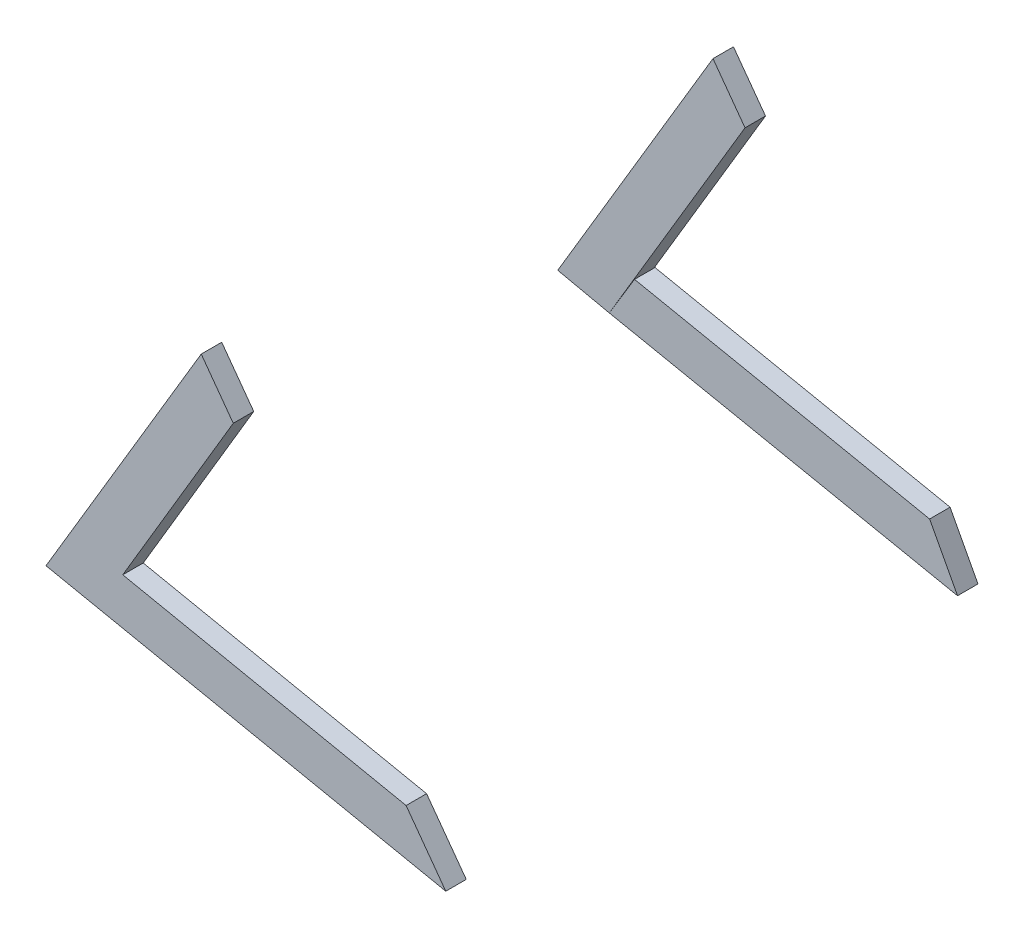
from build123d import *

# Parameters (mm, degrees)
EXTRUSION1_DEPTH = 25.4
EXTRUSION3_DEPTH = 25.4
EXTRUSION4_DEPTH = 25.4


with BuildPart() as part:
    # Sketch1 → Extrusion1 (new body)
    with BuildSketch(Plane(origin=(1143.778257891, 851.967349425, -406.391533333), x_dir=(-0.8080578390266975, -0.5891031563211183, -1.3322676295501878e-15), z_dir=(0, 0, -1))):
        Polygon((1567.245965508, 44.512521335), (1511.450306241, 67.886379625), (1259.420452439, -207.984148172), (1269.819424521, -281.048977056), align=None)
    extrude(amount=-EXTRUSION1_DEPTH)


with BuildPart() as body_2:
    # Sketch2 → Extrusion3 (new body)
    with BuildSketch(Plane(origin=(1143.778257891, 851.967349425, -406.391533333), x_dir=(-0.8080578390266975, -0.5891031563211183, -1.3322676295501878e-15), z_dir=(0, 0, -1))):
        Polygon((1264.334841181, 241.542342747), (1610.730323675, 93.381799656), (1567.245965508, 44.512521335), (1264.334841181, 174.073901193), align=None)
    extrude(amount=-EXTRUSION3_DEPTH)


with BuildPart() as body_3:
    # Sketch3 → Extrusion4 (new body)
    with BuildSketch(Plane(origin=(1129.213106706, 527.014896948, 254.008466667), x_dir=(0.8080578390266975, 0.5891031563211183, 1.3322676295501878e-15), z_dir=(0, 0, 1))):
        Polygon((-1061.134841181, 428.073901193), (-1061.134841181, 495.542342747), (-1407.530323675, 347.381799656), (-1066.619424521, -27.048977056), (-1066.619424521, 56.497273719), (-1308.250306241, 321.886379625), align=None)
    extrude(amount=-EXTRUSION4_DEPTH)


solid = Compound([part.part, body_2.part, body_3.part])
